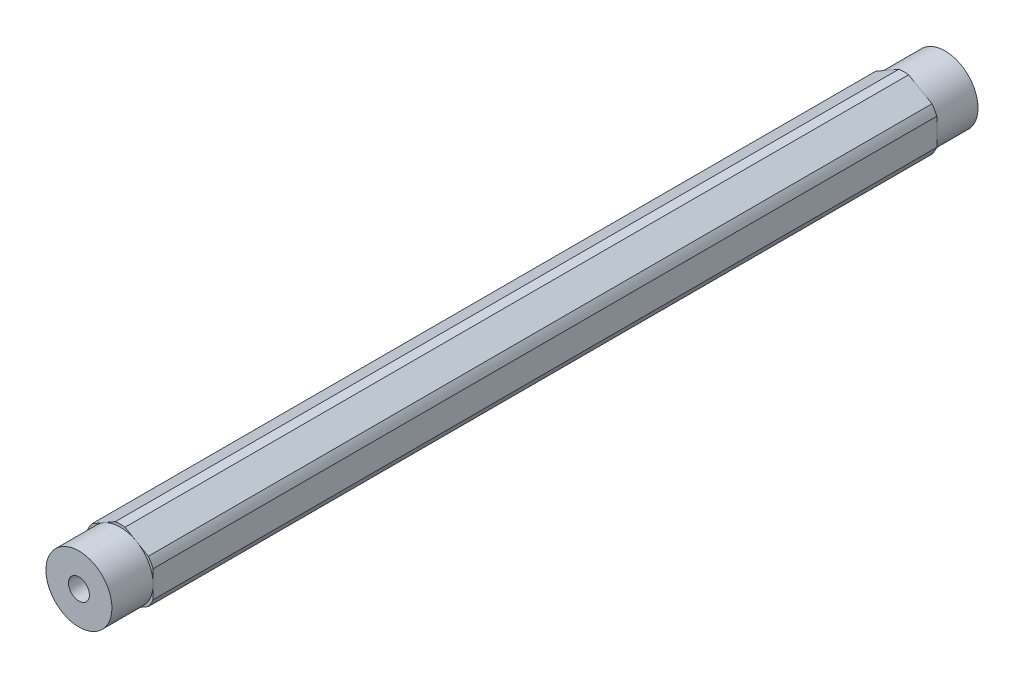
from build123d import *

# Parameters (mm, degrees)
SKETCH1_R           = 2.0193
BOSS_EXTRUDE1_DEPTH = 75.40625
SKETCH2_R           = 6.35
SKETCH2_R_2         = 2.0193
BOSS_EXTRUDE2_DEPTH = 7.9375


with BuildPart() as part:
    # Sketch1 → Boss-Extrude1 (new, symmetric)
    with BuildSketch(Plane.XY):
        with BuildLine():
            ThreePointArc((0.93173274, 6.79441227), (0, 6.858), (-0.93173274, 6.79441227))
            Line((-0.93173274, 6.79441227), (-5.41826726, 4.204110358))
            ThreePointArc((-5.41826726, 4.204110358), (-5.939202219, 3.429), (-6.35, 2.590301913))
            Line((-6.35, 2.590301913), (-6.35, -2.590301913))
            ThreePointArc((-6.35, -2.590301913), (-5.939202219, -3.429), (-5.41826726, -4.204110358))
            Line((-5.41826726, -4.204110358), (-0.93173274, -6.79441227))
            ThreePointArc((-0.93173274, -6.79441227), (0, -6.858), (0.93173274, -6.79441227))
            Line((0.93173274, -6.79441227), (5.41826726, -4.204110358))
            ThreePointArc((5.41826726, -4.204110358), (5.939202219, -3.429), (6.35, -2.590301913))
            Line((6.35, -2.590301913), (6.35, 2.590301913))
            ThreePointArc((6.35, 2.590301913), (5.939202219, 3.429), (5.41826726, 4.204110358))
            Line((5.41826726, 4.204110358), (0.93173274, 6.79441227))
        make_face()
        Circle(SKETCH1_R, mode=Mode.SUBTRACT)
    extrude(amount=BOSS_EXTRUDE1_DEPTH, both=True)

    # Sketch2 → Boss-Extrude2 (add)
    with BuildSketch(Plane.XY.offset(75.40625)):
        Circle(SKETCH2_R)
        Circle(SKETCH2_R_2, mode=Mode.SUBTRACT)
    boss_extrude2 = extrude(amount=BOSS_EXTRUDE2_DEPTH)

    # Mirror1: Boss-Extrude2 across plane
    add(boss_extrude2.mirror(Plane.XY))


solid = part.part
